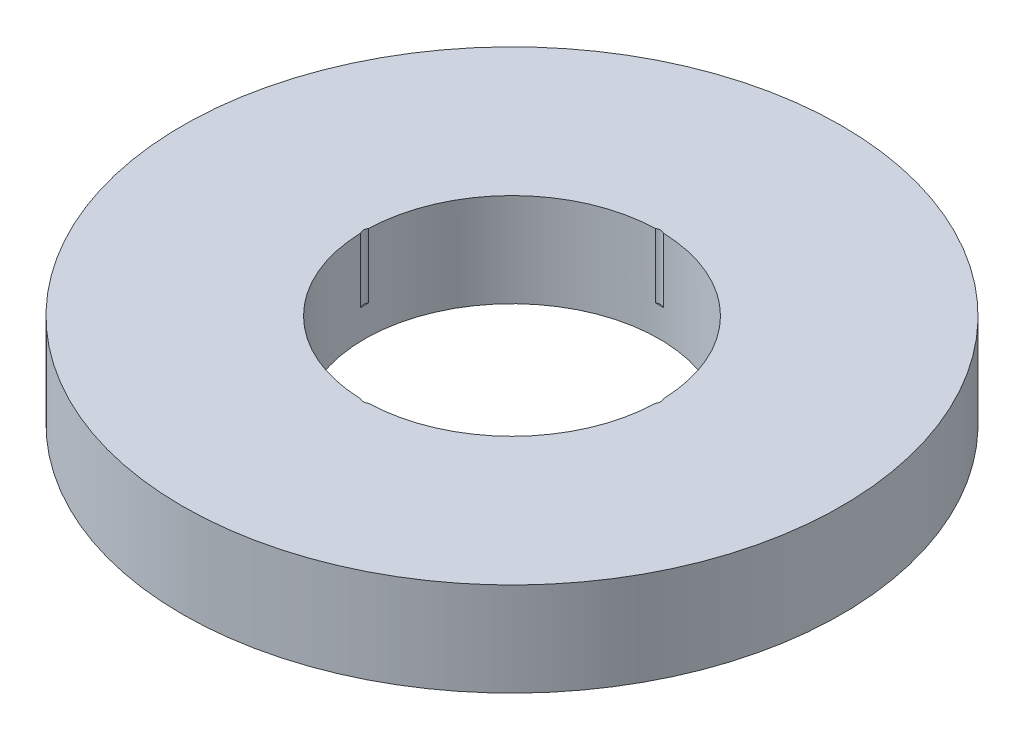
from build123d import *

# Parameters (mm, degrees)
SKETCH1_R           = 95
BOSS_EXTRUDE1_DEPTH = 27
SKETCH2_R           = 42.5
CUT_EXTRUDE1_DEPTH  = 138.03649149
SKETCH3_R           = 1.973562568
CUT_EXTRUDE2_DEPTH  = 18.5885467
CIRPATTERN1_COUNT   = 4


with BuildPart() as part:
    # Sketch1 → Boss-Extrude1 (new body)
    with BuildSketch(Plane(origin=(0, 0, 0), x_dir=(1, 0, 0), z_dir=(0, 1, 0))):
        Circle(SKETCH1_R)
    extrude(amount=BOSS_EXTRUDE1_DEPTH)

    # Sketch2 → Cut-Extrude1 (cut, through all)
    with BuildSketch(Plane(origin=(0, 0, 0), x_dir=(1, 0, 0), z_dir=(0, 1, 0))):
        Circle(SKETCH2_R)
    extrude(amount=CUT_EXTRUDE1_DEPTH, mode=Mode.SUBTRACT)

    # Sketch3 → Cut-Extrude2 (cut)
    with BuildSketch(Plane(origin=(0, 27, 0), x_dir=(1, 0, 0), z_dir=(0, 1, 0))):
        with Locations((-40.882315231, 0)):
            Circle(SKETCH3_R)
    cut_extrude2 = extrude(amount=-CUT_EXTRUDE2_DEPTH, mode=Mode.SUBTRACT)

    # CirPattern1: Cut-Extrude2 ×4 about axis
    cirpattern1_axis = Axis((0, 0, 0), (0, 1, 0))
    for i in range(1, CIRPATTERN1_COUNT):
        add(cut_extrude2.rotate(cirpattern1_axis, i * 360 / CIRPATTERN1_COUNT), mode=Mode.SUBTRACT)


solid = part.part
